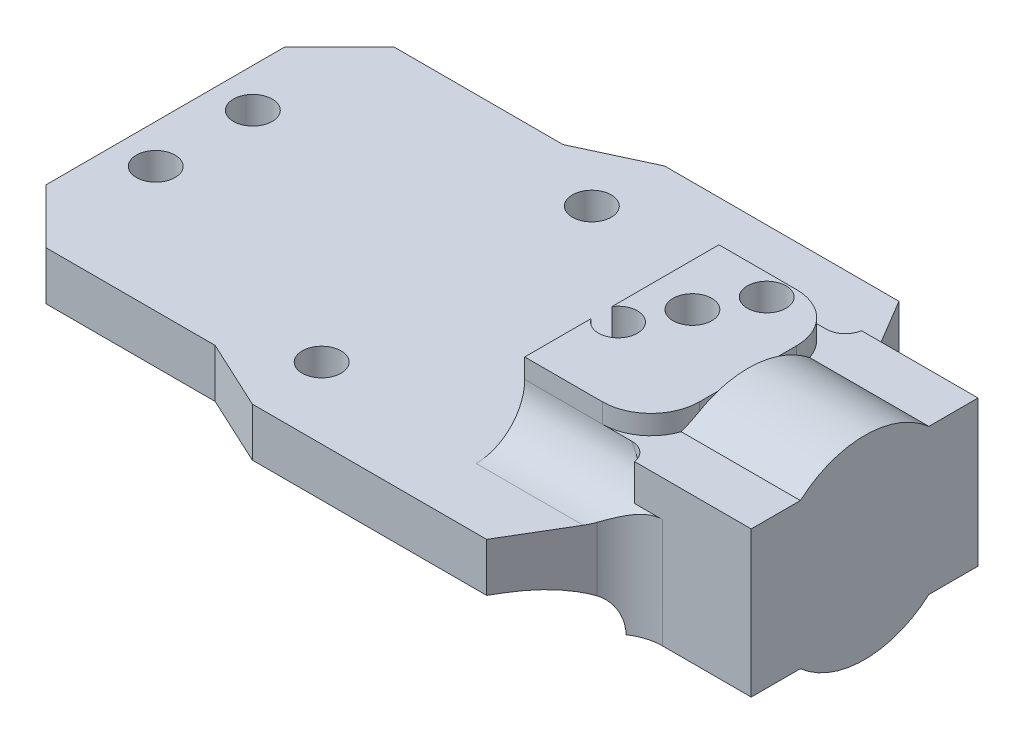
from build123d import *

# Parameters (mm, degrees)
ESQUISSE1_R             = 2.0000000000000004
ESQUISSE1_R_2           = 2.0000000000000027
ESQUISSE1_R_3           = 2.0000000000000036
BOSS_EXTRU_1_DEPTH      = 5
BOSS_EXTRU_2_DEPTH      = 7
BOSS_EXTRU_3_DEPTH      = 12
CONG_5_R                = 2
CONG_6_R                = 5
CONG_7_R                = 5
CONG_8_START            = 47
CONG_8_DEPTH            = 15.841158425
CONG_8_START_2          = 5
CONG_8_2_DEPTH          = 5
CONG_9_R                = 5
ESQUISSE4_R             = 2.000000000000003
ENL_V_MAT_EXTRU_1_DEPTH = 80.05832474405705


with BuildPart() as part:
    # Esquisse1 → Boss.-Extru.1 (new body)
    with BuildSketch(Plane(origin=(0, 0, 0), x_dir=(1, 0, 0), z_dir=(0, 1, 0))):
        Polygon((0, -17.259183673469387), (0, 7.340816326530612), (5.612244897959183, 12.953061224489796), (23.032211874798815, 12.953061224489796), (30.177388078602107, 16.27263677540768), (54.30760037473541, 16.27263677540768), (60, 6.7185363720326), (60, -16.636903718971652), (54.30760037473541, -26.19100412234673), (30.177388078602107, -26.19100412234673), (23.032211874798815, -22.87142857142884), (5.612244897959183, -22.87142857142857), align=None)
        with Locations(Location((4, 0.04081632653047534, 0), (0, 0, 270))):
            Circle(ESQUISSE1_R, mode=Mode.SUBTRACT)
        with Locations(Location((30, 8.953061224489796, 0), (0, 0, 270))):
            Circle(ESQUISSE1_R_2, mode=Mode.SUBTRACT)
        with Locations(Location((30, -18.871428571428574, 0), (0, 0, 90))):
            Circle(ESQUISSE1_R_3, mode=Mode.SUBTRACT)
        with Locations(Location((4, -9.959183673469525, 0), (0, 0, 90))):
            Circle(ESQUISSE1_R, mode=Mode.SUBTRACT)
    extrude(amount=BOSS_EXTRU_1_DEPTH)

    # Esquisse2 → Boss.-Extru.2 (add)
    with BuildSketch(Plane(origin=(0, 5, 0), x_dir=(1, 0, 0), z_dir=(0, 1, 0))):
        Polygon((60, -14.959183673469527), (47, -14.959183673469527), (47, 5.040816326530476), (60, 5.040816326530474), align=None)
    extrude(amount=BOSS_EXTRU_2_DEPTH)

    # Esquisse3 → Boss.-Extru.3 (add)
    with BuildSketch(Plane(origin=(60, 0, 0), x_dir=(0, 0, -1), z_dir=(1, 0, 0))):
        with BuildLine():
            Line((-16.636903718971652, 2.5), (-16.636903718971656, 10))
            Line((-16.636903718971656, 10), (-11.573561951131, 10))
            ThreePointArc((-11.573561951131, 10), (-4.959183673469523, 12.5), (1.655194604191953, 10))
            Line((1.655194604191953, 10), (6.7185363720326015, 10))
            Line((6.7185363720326015, 10), (6.7185363720326, 2.5))
            Line((6.7185363720326, 2.5), (6.7185363720326015, -4.999999999999996))
            Line((6.7185363720326015, -4.999999999999996), (1.6551946041919556, -4.9999999999999964))
            ThreePointArc((1.6551946041919556, -4.9999999999999964), (-4.959183673469523, -7.5), (-11.573561951131001, -4.999999999999998))
            Line((-11.573561951131001, -4.999999999999998), (-16.636903718971652, -4.999999999999999))
            Line((-16.636903718971652, -4.999999999999999), (-16.636903718971652, 2.5))
        make_face()
    extrude(amount=BOSS_EXTRU_3_DEPTH)

    # Congé5
    # the kernel refuses this fillet: 2 mm, written as the material it adds along each edge
    with BuildSketch(Plane(origin=(60, 0.06534219085981618, -5.040816326530474), x_dir=(-1, 0, 0), z_dir=(0, 1, 0))) as cong_5_piece_1:
        with BuildLine():
            CenterArc((1.9738631236560735, -2), CONG_5_R, 90, 80.72692923904819)
            Line((1.1369e-13, -1.677720045502146), (0, 0))
            Line((0, 0), (1.9738631236560735, 0))
        make_face()
    extrude(amount=9.934657809140184)
    with BuildSketch(Plane(origin=(60, 0.06534219085972737, 14.959183673469527), x_dir=(-8.894e-14, 0, 1), z_dir=(0, 1, 0))) as cong_5_piece_2:
        with BuildLine():
            CenterArc((2.0000000000001736, -1.9738631236559312), CONG_5_R, 99.27307076095664, 80.72692923904845)
            Line((1.7378e-13, -1.973863123656109), (0, 0))
            Line((0, 0), (1.677720045502154, 0))
        make_face()
    extrude(amount=9.934657809140273)

    # Congé6
    # the kernel refuses this fillet: 5 mm, written as the material it adds along each edge
    with BuildSketch(Plane(origin=(60, 0, -19.2185363720326), x_dir=(0, -1, 0), z_dir=(0, 0, 1))) as cong_6_piece_1_section:
        with BuildLine():
            CenterArc((CONG_6_R, -CONG_6_R), CONG_6_R, 90, 90)
            Line((0, -CONG_6_R), (0, 0))
            Line((0, 0), (CONG_6_R, 0))
        make_face()
    cong_6_piece_1 = extrude(amount=48.35544009100425, mode=Mode.PRIVATE)
    cong_6_piece_1 = split(cong_6_piece_1, bisect_by=Plane(origin=(54.50356872133156, 0, -15.943724298681133), z_dir=(-0.8590780139963325, 0, 0.5118446696685599)), keep=Keep.TOP, mode=Mode.PRIVATE)
    cong_6_piece_1 = split(cong_6_piece_1, bisect_by=Plane(origin=(75.76615699412946, 0, -9.824950123604522), z_dir=(-0.8590780139963324, 0, -0.5118446696685601)), keep=Keep.TOP, mode=Mode.PRIVATE)
    add(cong_6_piece_1)

    # Congé7
    cong_7_edges = [part.edges().sort_by_distance(p)[0] for p in [
        (60, 0, 16.636903718954546),
        (60, 0, -6.718536372036638),
    ]]
    fillet(cong_7_edges, radius=CONG_7_R)

    # Congé8: read off the stored shape, not the designer's step
    # Congé8 outline → Congé8 (add)
    with BuildSketch(Plane.YZ.offset(CONG_8_START)):
        with BuildLine():
            Line((5, 14.959183673), (10, 14.959183673))
            ThreePointArc((10, 14.959183673), (6.464466095, 16.423649767), (5, 19.959183673))
            Line((5, 19.959183673), (5, 14.959183673))
        make_face()
        with BuildLine():
            Line((10, -5.040816327), (5, -5.040816327))
            Line((5, -5.040816327), (5, -10.040816327))
            ThreePointArc((5, -10.040816327), (6.464466094, -6.505282421), (10, -5.040816327))
        make_face()
    extrude(amount=CONG_8_DEPTH)

    # Cong_8 2 outline → Cong_8 2 (cut)
    with BuildSketch(Plane(origin=(0, 0, 0), x_dir=(1, 0, 0), z_dir=(0, 1, 0)).offset(CONG_8_START_2)):
        with BuildLine():
            Line((62.841158425, -21), (62.841158325, -16.636903719))
            ThreePointArc((62.841158325, -16.636903719), (60.370947478, -17.289714009), (58.545768255, -19.077680371))
            Line((58.545768255, -19.077680371), (57.40043682, -21))
            Line((57.40043682, -21), (62.841158425, -21))
        make_face()
        with BuildLine():
            Line((57, 12), (57, 11.753724185))
            Line((57, 11.753724185), (58.545768255, 9.159313024))
            ThreePointArc((58.545768255, 9.159313024), (60.370947478, 7.371346662), (62.841158325, 6.718536372))
            Line((62.841158325, 6.718536372), (62.841158425, 12))
            Line((62.841158425, 12), (57, 12))
        make_face()
    extrude(amount=CONG_8_2_DEPTH, mode=Mode.SUBTRACT)

    # Congé9
    # the kernel refuses this fillet: 5 mm, written as the material it takes off along each edge
    with BuildSketch(Plane(origin=(60, 10, 14.959183673469527), x_dir=(-1, 0, 0), z_dir=(0, 1, 0))) as cong_9_piece_1_section:
        with BuildLine():
            CenterArc((CONG_9_R, -CONG_9_R), CONG_9_R, 90, 89.99999999999997)
            Line((0, -CONG_9_R), (0, 0))
            Line((0, 0), (CONG_9_R, 0))
        make_face()
    cong_9_piece_1 = extrude(amount=14.5, mode=Mode.PRIVATE)
    cong_9_piece_1 = cong_9_piece_1 - Plane(origin=(60, 2.5, 4.959183673469523), x_dir=(0, 0.75, 0.6614378277661477), z_dir=(-1, 0, 0)) * Cylinder(10, 49, mode=Mode.PRIVATE)
    add(cong_9_piece_1, mode=Mode.SUBTRACT)
    with BuildSketch(Plane(origin=(60, 10, -5.040816326530474), x_dir=(0, 0, 1), z_dir=(0, 1, 0))) as cong_9_piece_2_section:
        with BuildLine():
            CenterArc((CONG_9_R, -CONG_9_R), CONG_9_R, 90, 90)
            Line((-8.9e-16, -CONG_9_R), (0, 0))
            Line((0, 0), (CONG_9_R, 0))
        make_face()
    cong_9_piece_2 = extrude(amount=14.5, mode=Mode.PRIVATE)
    cong_9_piece_2 = cong_9_piece_2 - Plane(origin=(60, 2.5, 4.959183673469523), x_dir=(0, 0.75, 0.6614378277661477), z_dir=(-1, 0, 0)) * Cylinder(10, 49, mode=Mode.PRIVATE)
    add(cong_9_piece_2, mode=Mode.SUBTRACT)

    # Esquisse4 → Enlèv. mat.-Extru.1 (cut, through all)
    with BuildSketch(Plane(origin=(0, 12, 0), x_dir=(1, 0, 0), z_dir=(0, 1, 0))):
        with Locations(Location((54.117759478937174, 2.840816326530474, 0), (0, 0, 270))):
            Circle(ESQUISSE4_R)
        with Locations(Location((51.40596187001204, -2.099183673469524, 0), (0, 0, 270))):
            Circle(ESQUISSE4_R)
        with Locations(Location((48.691938447086365, -7.043238371772405, 0), (0, 0, 212.224070666))):
            Circle(ESQUISSE4_R)
    extrude(amount=-ENL_V_MAT_EXTRU_1_DEPTH, mode=Mode.SUBTRACT)


solid = part.part
